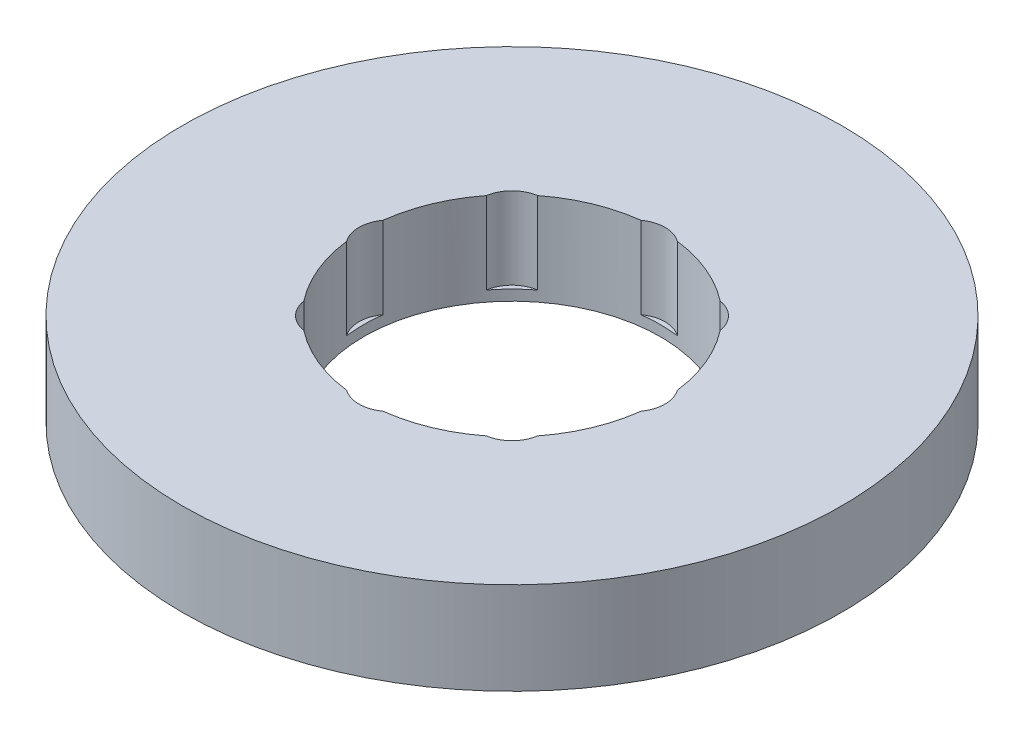
from build123d import *

# Parameters (mm, degrees)
SKETCH1_R           = 100
BOSS_EXTRUDE1_DEPTH = 28
SKETCH2_R           = 45
CUT_EXTRUDE1_DEPTH  = 145.166570328
SKETCH3_R           = 9.403926579
CUT_EXTRUDE2_DEPTH  = 24.811520444
CIRPATTERN1_COUNT   = 8


with BuildPart() as part:
    # Sketch1 → Boss-Extrude1 (new body)
    with BuildSketch(Plane(origin=(0, 0, 0), x_dir=(1, 0, 0), z_dir=(0, 1, 0))):
        Circle(SKETCH1_R)
    extrude(amount=BOSS_EXTRUDE1_DEPTH)

    # Sketch2 → Cut-Extrude1 (cut, through all)
    with BuildSketch(Plane(origin=(0, 0, 0), x_dir=(1, 0, 0), z_dir=(0, 1, 0))):
        Circle(SKETCH2_R)
    extrude(amount=CUT_EXTRUDE1_DEPTH, mode=Mode.SUBTRACT)

    # Sketch3 → Cut-Extrude2 (cut)
    with BuildSketch(Plane(origin=(0, 28, 0), x_dir=(1, 0, 0), z_dir=(0, 1, 0))):
        with Locations((-37.040005222, 0)):
            Circle(SKETCH3_R)
    cut_extrude2 = extrude(amount=-CUT_EXTRUDE2_DEPTH, mode=Mode.SUBTRACT)

    # CirPattern1: Cut-Extrude2 ×8 about axis
    cirpattern1_axis = Axis((0, 0, 0), (0, 1, 0))
    for i in range(1, CIRPATTERN1_COUNT):
        add(cut_extrude2.rotate(cirpattern1_axis, i * 360 / CIRPATTERN1_COUNT), mode=Mode.SUBTRACT)


solid = part.part
